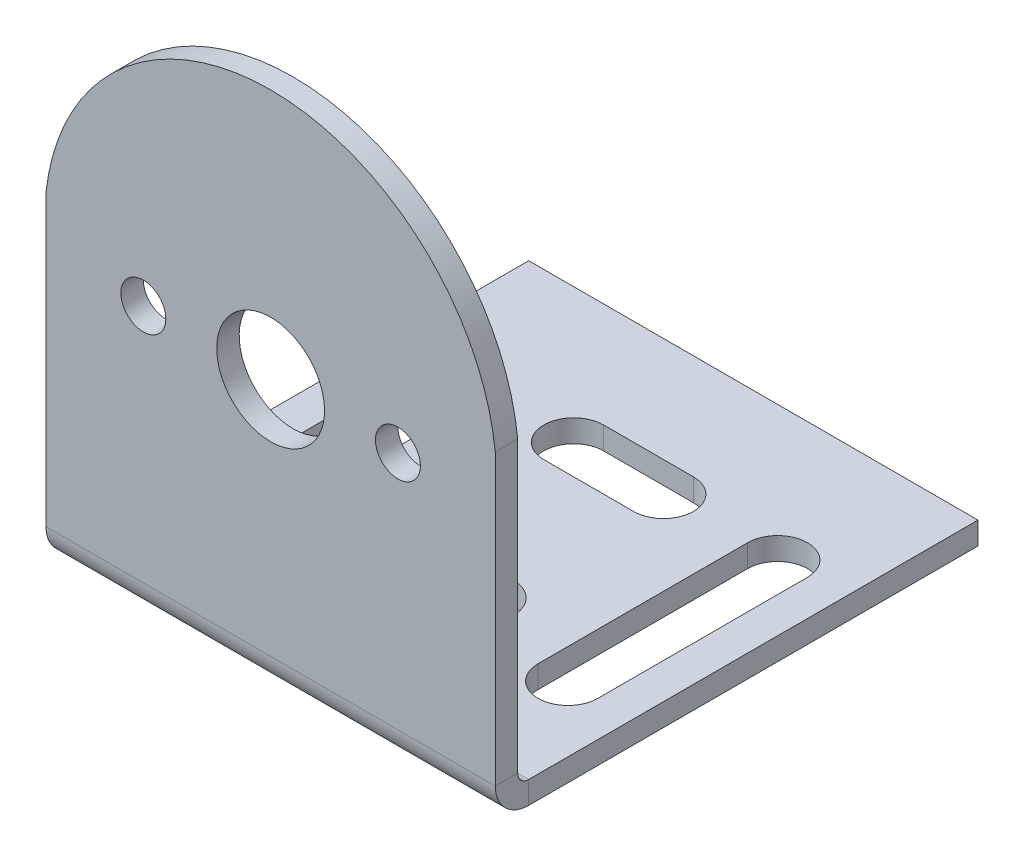
from build123d import *

# Parameters (mm, degrees)
SKETCH1_W                = 30
SKETCH1_H                = 30
BASE_FLANGE1_DEPTH       = 1.5
EDGE_FLANGE1_DEPTH       = 30
EDGE_FLANGE1_START       = -1.5
EDGE_FLANGE1_PROFILE_R   = 1.5
EDGE_FLANGE1_PROFILE_R_2 = 3.6
EDGE_FLANGE1_FLAT_DEPTH  = 1.5


# Sheet-metal steps are written as plain solids
with BuildPart() as part:
    # Sketch1 → Base-Flange1 (new body)
    with BuildSketch(Plane(origin=(0, 0, 0), x_dir=(1, 0, 0), z_dir=(0, 1, 0))):
        Rectangle(SKETCH1_W, SKETCH1_H)
        with BuildLine():
            Line((-8.617716364, 6), (-8.617716364, -8))
            ThreePointArc((-8.617716364, -8), (-10.617716364, -10), (-12.617716364, -8))
            Line((-12.617716364, -8), (-12.617716364, 6))
            ThreePointArc((-12.617716364, 6), (-10.617716364, 8), (-8.617716364, 6))
        make_face(mode=Mode.SUBTRACT)
        with BuildLine():
            Line((8.617716364, 6), (8.617716364, -8))
            ThreePointArc((8.617716364, -8), (10.617716364, -10), (12.617716364, -8))
            Line((12.617716364, -8), (12.617716364, 6))
            ThreePointArc((12.617716364, 6), (10.617716364, 8), (8.617716364, 6))
        make_face(mode=Mode.SUBTRACT)
        with BuildLine():
            Line((-3, 8), (3, 8))
            ThreePointArc((3, 8), (5, 6), (3, 4))
            Line((3, 4), (-3, 4))
            ThreePointArc((-3, 4), (-5, 6), (-3, 8))
        make_face(mode=Mode.SUBTRACT)
        with BuildLine():
            Line((-3, -8), (3, -8))
            ThreePointArc((3, -8), (5, -6), (3, -4))
            Line((3, -4), (-3, -4))
            ThreePointArc((-3, -4), (-5, -6), (-3, -8))
        make_face(mode=Mode.SUBTRACT)
    extrude(amount=-BASE_FLANGE1_DEPTH)

    # Edge-Flange1 bend section (across the edge) → Edge-Flange1 (add)
    with BuildSketch(Plane(origin=(-15, 0, 15.7366), x_dir=(0, 0, -1), z_dir=(1, 0, 0))):
        with BuildLine():
            Line((-1.5, 0.7366), (0, 0.7366))
            ThreePointArc((0, 0.7366), (0.215745145, 0.215745145), (0.7366, 0))
            Line((0.7366, 0), (0.7366, -1.5))
            ThreePointArc((0.7366, -1.5), (-0.844915027, -0.844915027), (-1.5, 0.7366))
        make_face()
    extrude(amount=EDGE_FLANGE1_DEPTH)

    # Edge-Flange1 profile (on flange) → Edge-Flange1 flat (add)
    with BuildSketch(Plane(origin=(0, 0, 15.7366), x_dir=(-1, 0, 0), z_dir=(0, 0, -1)).offset(EDGE_FLANGE1_START)):
        with BuildLine():
            ThreePointArc((15, 20.067164179), (0, 33.5), (-15, 20.067164179))
            Line((-15, 20.067164179), (-15, 0.7366))
            Line((-15, 0.7366), (15, 0.7366))
            Line((15, 0.7366), (15, 20.067164179))
        make_face()
        with Locations((8.5, 16.75)):
            Circle(EDGE_FLANGE1_PROFILE_R, mode=Mode.SUBTRACT)
        with Locations((0, 16.75)):
            Circle(EDGE_FLANGE1_PROFILE_R_2, mode=Mode.SUBTRACT)
        with Locations((-8.5, 16.75)):
            Circle(EDGE_FLANGE1_PROFILE_R, mode=Mode.SUBTRACT)
    extrude(amount=EDGE_FLANGE1_FLAT_DEPTH)


solid = part.part
